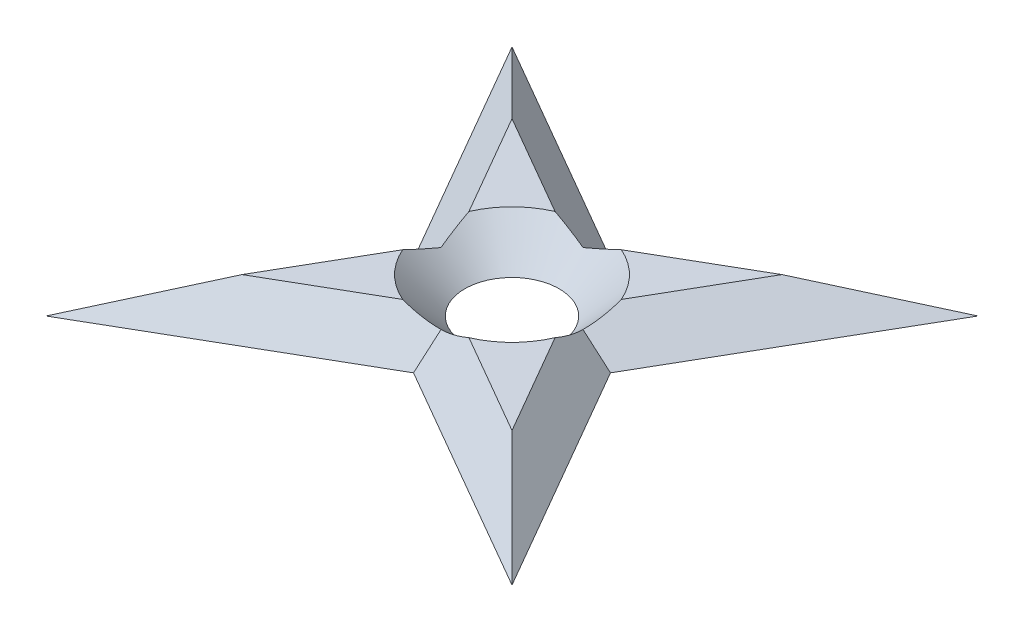
from build123d import *

# Parameters (mm, degrees)
SKETCH1_R           = 13.155
BOSS_EXTRUDE1_DEPTH = 10
CHAMFER4_SIZE       = 10


with BuildPart() as part:
    # Sketch1 → Boss-Extrude1 (new body)
    with BuildSketch(Plane(origin=(0, 0, 0), x_dir=(1, 0, 0), z_dir=(0, 1, 0))):
        Polygon((0, 0), (37.5, 64.951905284), (0, 129.903810568), (64.951905284, 92.403810568), (129.903810568, 129.903810568), (92.403810568, 64.951905284), (129.903810568, 0), (64.951905284, 37.5), align=None)
        with Locations(Location((64.951905284, 64.951905284, 0), (0, 0, 270))):
            Circle(SKETCH1_R, mode=Mode.SUBTRACT)
    extrude(amount=BOSS_EXTRUDE1_DEPTH)

    # Chamfer4
    # the kernel refuses this chamfer: 10 mm, written as the material it takes off along each edge
    with BuildSketch(Plane(origin=(64.951905284, 10, -64.951905284), x_dir=(0, 0, 1), z_dir=(-1, 0, 0))) as chamfer4_piece_1:
        Polygon((13.155, -CHAMFER4_SIZE), (13.155 + CHAMFER4_SIZE, 0), (13.155, 0), align=None)
    revolve(axis=Axis((64.951905284, 10, -64.951905284), (0, 1, 0)), mode=Mode.SUBTRACT)
    with BuildSketch(Plane(origin=(-12.85841494, 10, 22.271427981), x_dir=(-0.023812127644090117, -0.9996219169112968, -0.013747938305293196), z_dir=(0.5000000000000011, 0, -0.866025403784438))) as chamfer4_piece_2_section:
        Polygon((CHAMFER4_SIZE * 0.999621916911, -CHAMFER4_SIZE * 0.0274958766106), (-CHAMFER4_SIZE * 0.0274958766106, -CHAMFER4_SIZE * 0.999621916911), (0, 0), align=None)
    chamfer4_piece_2 = extrude(amount=126.433659759, mode=Mode.PRIVATE)
    chamfer4_piece_2 = split(chamfer4_piece_2, bisect_by=Plane(origin=(51.736915966, 6.682227924, -40.292843487), z_dir=(-0.8660254037844383, 0, 0.5000000000000009)), keep=Keep.TOP, mode=Mode.PRIVATE)
    add(chamfer4_piece_2, mode=Mode.SUBTRACT)
    with BuildSketch(Plane(origin=(50.35841494, 10, -42.680477303), x_dir=(-0.02381212764408977, -0.9996219169112968, 0.013747938305292988), z_dir=(-0.5000000000000009, 0, -0.8660254037844383))) as chamfer4_piece_3_section:
        Polygon((CHAMFER4_SIZE * 0.999621916911, -CHAMFER4_SIZE * 0.0274958766106), (-CHAMFER4_SIZE * 0.0274958766106, -CHAMFER4_SIZE * 0.999621916911), (0, 0), align=None)
    chamfer4_piece_3 = extrude(amount=126.433659759, mode=Mode.PRIVATE)
    chamfer4_piece_3 = split(chamfer4_piece_3, bisect_by=Plane(origin=(51.736915966, 6.682227924, -89.610967081), z_dir=(-0.866025403784438, 0, -0.5000000000000011)), keep=Keep.TOP, mode=Mode.PRIVATE)
    add(chamfer4_piece_3, mode=Mode.SUBTRACT)
    with BuildSketch(Plane(origin=(-22.271427981, 10, -142.762225507), x_dir=(0.01374793830529321, -0.9996219169112968, -0.023812127644090134), z_dir=(0.866025403784438, 0, 0.5000000000000012))) as chamfer4_piece_4_section:
        Polygon((CHAMFER4_SIZE * 0.999621916911, -CHAMFER4_SIZE * 0.0274958766106), (-CHAMFER4_SIZE * 0.0274958766106, -CHAMFER4_SIZE * 0.999621916911), (0, 0), align=None)
    chamfer4_piece_4 = extrude(amount=126.433659759, mode=Mode.PRIVATE)
    chamfer4_piece_4 = split(chamfer4_piece_4, bisect_by=Plane(origin=(40.292843487, 6.682227924, -78.166894601), z_dir=(-0.5000000000000012, 0, -0.866025403784438)), keep=Keep.TOP, mode=Mode.PRIVATE)
    add(chamfer4_piece_4, mode=Mode.SUBTRACT)
    with BuildSketch(Plane(origin=(42.680477303, 10, -79.545395628), x_dir=(-0.01374793830529287, -0.9996219169112968, -0.023812127644089548), z_dir=(0.866025403784438, 0, -0.5000000000000012))) as chamfer4_piece_5_section:
        Polygon((CHAMFER4_SIZE * 0.999621916911, -CHAMFER4_SIZE * 0.0274958766106), (-CHAMFER4_SIZE * 0.0274958766106, -CHAMFER4_SIZE * 0.999621916911), (0, 0), align=None)
    chamfer4_piece_5 = extrude(amount=126.433659759, mode=Mode.PRIVATE)
    chamfer4_piece_5 = split(chamfer4_piece_5, bisect_by=Plane(origin=(89.610967081, 6.682227924, -78.166894601), z_dir=(0.5000000000000012, 0, -0.866025403784438)), keep=Keep.TOP, mode=Mode.PRIVATE)
    add(chamfer4_piece_5, mode=Mode.SUBTRACT)
    with BuildSketch(Plane(origin=(142.762225507, 10, -152.175238548), x_dir=(0.023812127644092358, -0.9996219169112965, 0.013747938305294477), z_dir=(-0.5000000000000007, 0, 0.8660254037844384))) as chamfer4_piece_6_section:
        Polygon((CHAMFER4_SIZE * 0.999621916911, -CHAMFER4_SIZE * 0.0274958766106), (-CHAMFER4_SIZE * 0.0274958766106, -CHAMFER4_SIZE * 0.999621916911), (0, 0), align=None)
    chamfer4_piece_6 = extrude(amount=126.433659759, mode=Mode.PRIVATE)
    chamfer4_piece_6 = split(chamfer4_piece_6, bisect_by=Plane(origin=(78.166894601, 6.682227924, -89.610967081), z_dir=(0.8660254037844382, 0, -0.500000000000001)), keep=Keep.TOP, mode=Mode.PRIVATE)
    add(chamfer4_piece_6, mode=Mode.SUBTRACT)
    with BuildSketch(Plane(origin=(79.545395628, 10, -87.223333264), x_dir=(0.023812127644090287, -0.9996219169112968, -0.013747938305293292), z_dir=(0.500000000000001, 0, 0.8660254037844382))) as chamfer4_piece_7_section:
        Polygon((CHAMFER4_SIZE * 0.999621916911, -CHAMFER4_SIZE * 0.0274958766106), (-CHAMFER4_SIZE * 0.0274958766106, -CHAMFER4_SIZE * 0.999621916911), (0, 0), align=None)
    chamfer4_piece_7 = extrude(amount=126.433659759, mode=Mode.PRIVATE)
    chamfer4_piece_7 = split(chamfer4_piece_7, bisect_by=Plane(origin=(78.166894601, 6.682227924, -40.292843487), z_dir=(0.8660254037844384, 0, 0.5000000000000007)), keep=Keep.TOP, mode=Mode.PRIVATE)
    add(chamfer4_piece_7, mode=Mode.SUBTRACT)
    with BuildSketch(Plane(origin=(152.175238548, 10, 12.85841494), x_dir=(-0.013747938305293, -0.9996219169112968, 0.023812127644089767), z_dir=(-0.8660254037844379, 0, -0.5000000000000012))) as chamfer4_piece_8_section:
        Polygon((CHAMFER4_SIZE * 0.999621916911, -CHAMFER4_SIZE * 0.0274958766106), (-CHAMFER4_SIZE * 0.0274958766106, -CHAMFER4_SIZE * 0.999621916911), (0, 0), align=None)
    chamfer4_piece_8 = extrude(amount=126.433659759, mode=Mode.PRIVATE)
    chamfer4_piece_8 = split(chamfer4_piece_8, bisect_by=Plane(origin=(89.610967081, 6.682227924, -51.736915966), z_dir=(0.5000000000000012, 0, 0.8660254037844379)), keep=Keep.TOP, mode=Mode.PRIVATE)
    add(chamfer4_piece_8, mode=Mode.SUBTRACT)
    with BuildSketch(Plane(origin=(87.223333264, 10, -50.35841494), x_dir=(0.013747938305293599, -0.9996219169112968, 0.0238121276440908), z_dir=(-0.8660254037844379, 0, 0.5000000000000012))) as chamfer4_piece_9_section:
        Polygon((CHAMFER4_SIZE * 0.999621916911, -CHAMFER4_SIZE * 0.0274958766106), (-CHAMFER4_SIZE * 0.0274958766106, -CHAMFER4_SIZE * 0.999621916911), (0, 0), align=None)
    chamfer4_piece_9 = extrude(amount=126.433659759, mode=Mode.PRIVATE)
    chamfer4_piece_9 = split(chamfer4_piece_9, bisect_by=Plane(origin=(40.292843487, 6.682227924, -51.736915966), z_dir=(-0.5000000000000012, 0, 0.8660254037844379)), keep=Keep.TOP, mode=Mode.PRIVATE)
    add(chamfer4_piece_9, mode=Mode.SUBTRACT)
    with BuildSketch(Plane(origin=(-12.85841494, 10, 22.271427981), x_dir=(-0.023812127644090117, -0.9996219169112968, -0.013747938305293196), z_dir=(0.5000000000000011, 0, -0.866025403784438))) as chamfer4_piece_10a_section:
        Polygon((CHAMFER4_SIZE * 0.999621916911, -CHAMFER4_SIZE * 0.0274958766106), (-CHAMFER4_SIZE * 0.0274958766106, -CHAMFER4_SIZE * 0.999621916911), (0, 0), align=None)
    chamfer4_piece_10a = extrude(amount=126.433659759, mode=Mode.PRIVATE)
    chamfer4_piece_10a = split(chamfer4_piece_10a, bisect_by=Plane(origin=(36.018509, 6.773025627, -67.517922967), z_dir=(0.8660254037844383, 0, -0.5000000000000009)), keep=Keep.TOP, mode=Mode.PRIVATE)
    with BuildSketch(Plane(origin=(50.35841494, 10, -42.680477303), x_dir=(-0.02381212764408977, -0.9996219169112968, 0.013747938305292988), z_dir=(-0.5000000000000009, 0, -0.8660254037844383))) as chamfer4_piece_10b_section:
        Polygon((CHAMFER4_SIZE * 0.999621916911, -CHAMFER4_SIZE * 0.0274958766106), (-CHAMFER4_SIZE * 0.0274958766106, -CHAMFER4_SIZE * 0.999621916911), (0, 0), align=None)
    chamfer4_piece_10b = extrude(amount=126.433659759, mode=Mode.PRIVATE)
    chamfer4_piece_10b = split(chamfer4_piece_10b, bisect_by=Plane(origin=(36.018509, 6.773025627, -62.385887601), z_dir=(0.866025403784438, 0, 0.5000000000000011)), keep=Keep.TOP, mode=Mode.PRIVATE)
    chamfer4_piece_10 = chamfer4_piece_10a & chamfer4_piece_10b
    add(chamfer4_piece_10, mode=Mode.SUBTRACT)
    with BuildSketch(Plane(origin=(-22.271427981, 10, -142.762225507), x_dir=(0.01374793830529321, -0.9996219169112968, -0.023812127644090134), z_dir=(0.866025403784438, 0, 0.5000000000000012))) as chamfer4_piece_11a_section:
        Polygon((CHAMFER4_SIZE * 0.999621916911, -CHAMFER4_SIZE * 0.0274958766106), (-CHAMFER4_SIZE * 0.0274958766106, -CHAMFER4_SIZE * 0.999621916911), (0, 0), align=None)
    chamfer4_piece_11a = extrude(amount=126.433659759, mode=Mode.PRIVATE)
    chamfer4_piece_11a = split(chamfer4_piece_11a, bisect_by=Plane(origin=(67.517922967, 6.773025627, -93.885301568), z_dir=(0.5000000000000012, 0, 0.866025403784438)), keep=Keep.TOP, mode=Mode.PRIVATE)
    with BuildSketch(Plane(origin=(42.680477303, 10, -79.545395628), x_dir=(-0.01374793830529287, -0.9996219169112968, -0.023812127644089548), z_dir=(0.866025403784438, 0, -0.5000000000000012))) as chamfer4_piece_11b_section:
        Polygon((CHAMFER4_SIZE * 0.999621916911, -CHAMFER4_SIZE * 0.0274958766106), (-CHAMFER4_SIZE * 0.0274958766106, -CHAMFER4_SIZE * 0.999621916911), (0, 0), align=None)
    chamfer4_piece_11b = extrude(amount=126.433659759, mode=Mode.PRIVATE)
    chamfer4_piece_11b = split(chamfer4_piece_11b, bisect_by=Plane(origin=(62.385887601, 6.773025627, -93.885301568), z_dir=(-0.5000000000000012, 0, 0.866025403784438)), keep=Keep.TOP, mode=Mode.PRIVATE)
    chamfer4_piece_11 = chamfer4_piece_11a & chamfer4_piece_11b
    add(chamfer4_piece_11, mode=Mode.SUBTRACT)
    with BuildSketch(Plane(origin=(142.762225507, 10, -152.175238548), x_dir=(0.023812127644092358, -0.9996219169112965, 0.013747938305294477), z_dir=(-0.5000000000000007, 0, 0.8660254037844384))) as chamfer4_piece_12a_section:
        Polygon((CHAMFER4_SIZE * 0.999621916911, -CHAMFER4_SIZE * 0.0274958766106), (-CHAMFER4_SIZE * 0.0274958766106, -CHAMFER4_SIZE * 0.999621916911), (0, 0), align=None)
    chamfer4_piece_12a = extrude(amount=126.433659759, mode=Mode.PRIVATE)
    chamfer4_piece_12a = split(chamfer4_piece_12a, bisect_by=Plane(origin=(93.885301568, 6.773025627, -62.385887601), z_dir=(-0.8660254037844382, 0, 0.500000000000001)), keep=Keep.TOP, mode=Mode.PRIVATE)
    with BuildSketch(Plane(origin=(79.545395628, 10, -87.223333264), x_dir=(0.023812127644090287, -0.9996219169112968, -0.013747938305293292), z_dir=(0.500000000000001, 0, 0.8660254037844382))) as chamfer4_piece_12b_section:
        Polygon((CHAMFER4_SIZE * 0.999621916911, -CHAMFER4_SIZE * 0.0274958766106), (-CHAMFER4_SIZE * 0.0274958766106, -CHAMFER4_SIZE * 0.999621916911), (0, 0), align=None)
    chamfer4_piece_12b = extrude(amount=126.433659759, mode=Mode.PRIVATE)
    chamfer4_piece_12b = split(chamfer4_piece_12b, bisect_by=Plane(origin=(93.885301568, 6.773025627, -67.517922967), z_dir=(-0.8660254037844384, 0, -0.5000000000000007)), keep=Keep.TOP, mode=Mode.PRIVATE)
    chamfer4_piece_12 = chamfer4_piece_12a & chamfer4_piece_12b
    add(chamfer4_piece_12, mode=Mode.SUBTRACT)
    with BuildSketch(Plane(origin=(152.175238548, 10, 12.85841494), x_dir=(-0.013747938305293, -0.9996219169112968, 0.023812127644089767), z_dir=(-0.8660254037844379, 0, -0.5000000000000012))) as chamfer4_piece_13a_section:
        Polygon((CHAMFER4_SIZE * 0.999621916911, -CHAMFER4_SIZE * 0.0274958766106), (-CHAMFER4_SIZE * 0.0274958766106, -CHAMFER4_SIZE * 0.999621916911), (0, 0), align=None)
    chamfer4_piece_13a = extrude(amount=126.433659759, mode=Mode.PRIVATE)
    chamfer4_piece_13a = split(chamfer4_piece_13a, bisect_by=Plane(origin=(62.385887601, 6.773025627, -36.018509), z_dir=(-0.5000000000000012, 0, -0.8660254037844379)), keep=Keep.TOP, mode=Mode.PRIVATE)
    with BuildSketch(Plane(origin=(87.223333264, 10, -50.35841494), x_dir=(0.013747938305293599, -0.9996219169112968, 0.0238121276440908), z_dir=(-0.8660254037844379, 0, 0.5000000000000012))) as chamfer4_piece_13b_section:
        Polygon((CHAMFER4_SIZE * 0.999621916911, -CHAMFER4_SIZE * 0.0274958766106), (-CHAMFER4_SIZE * 0.0274958766106, -CHAMFER4_SIZE * 0.999621916911), (0, 0), align=None)
    chamfer4_piece_13b = extrude(amount=126.433659759, mode=Mode.PRIVATE)
    chamfer4_piece_13b = split(chamfer4_piece_13b, bisect_by=Plane(origin=(67.517922967, 6.773025627, -36.018509), z_dir=(0.5000000000000012, 0, -0.8660254037844379)), keep=Keep.TOP, mode=Mode.PRIVATE)
    chamfer4_piece_13 = chamfer4_piece_13a & chamfer4_piece_13b
    add(chamfer4_piece_13, mode=Mode.SUBTRACT)


solid = part.part
